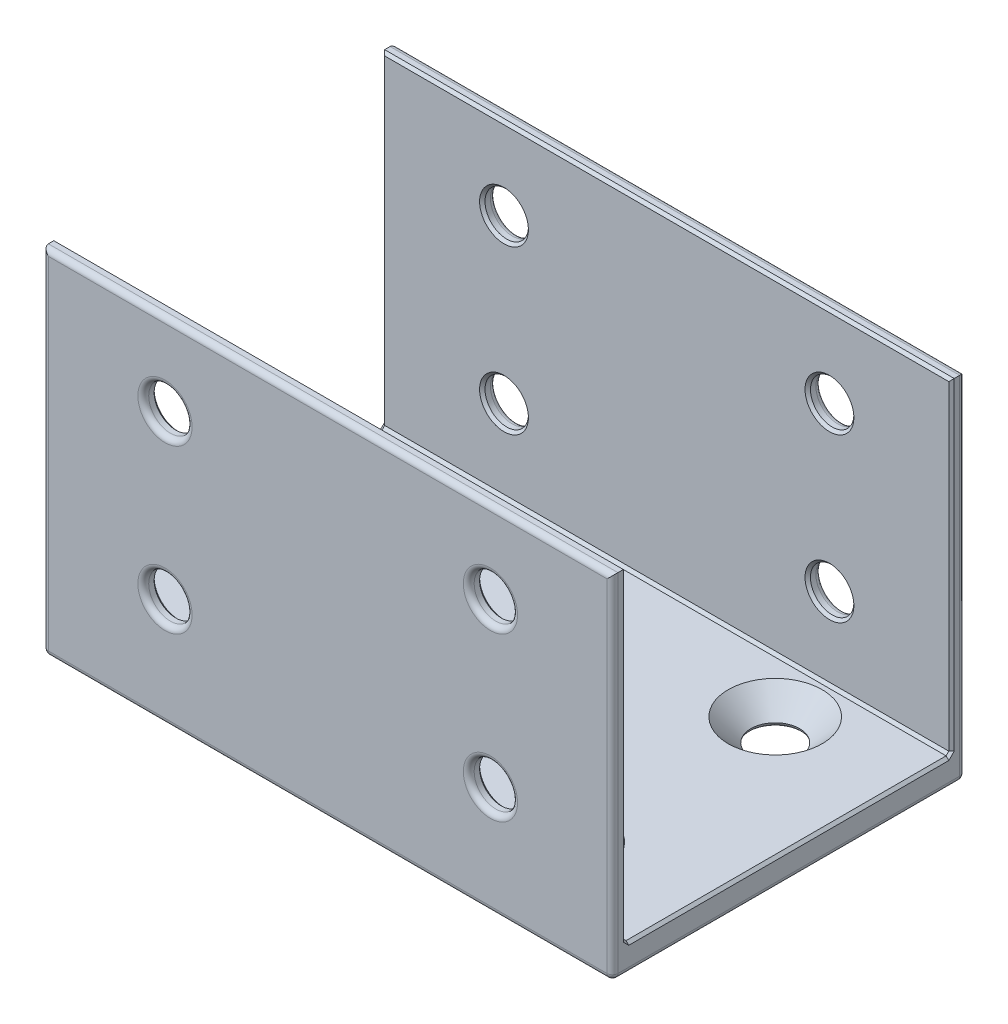
from build123d import *

# Parameters (mm, degrees)
SZKIC1_W                    = 105
SZKIC1_H                    = 65
DODANIE_WYCI_GNI_CIE1_DEPTH = 65
WYTNIJ_WYCI_GNI_CIE1_REACH  = 129.696
SZKIC2_W                    = 60
SZKIC2_H                    = 60
OTWORY_USTALAJ_CE_8_0MM2_D  = 8
ZAOKR_GLENIE1_R             = 1
SFAZOWANIE1_SIZE            = 0.5


with BuildPart() as part:
    # Szkic1 → Dodanie-wyciągnięcie1 (new body)
    with BuildSketch(Plane(origin=(0, 0, 0), x_dir=(1, 0, 0), z_dir=(0, 1, 0))):
        Rectangle(SZKIC1_W, SZKIC1_H)
    extrude(amount=DODANIE_WYCI_GNI_CIE1_DEPTH)

    # Szkic2 → Wytnij-wyciągnięcie1 (cut, up to next)
    with BuildSketch(Plane(origin=(52.5, 0, 0), x_dir=(0, 0, -1), z_dir=(1, 0, 0)), mode=Mode.PRIVATE) as wytnij_wyci_gni_cie1_sk1:
        with Locations((0, 35)):
            Rectangle(SZKIC2_W, SZKIC2_H)
    wytnij_wyci_gni_cie1_tool1 = extrude(wytnij_wyci_gni_cie1_sk1.sketch, amount=-WYTNIJ_WYCI_GNI_CIE1_REACH, mode=Mode.PRIVATE) & part.part
    add(wytnij_wyci_gni_cie1_tool1.solids().sort_by_distance((52.5, 35, 0))[0], mode=Mode.SUBTRACT)

    # Szkic5 → Pogłębienie stożkowe pod M8 Śrubę z łbem soczewkowym1 (revolve, cut)
    with BuildSketch(Plane(origin=(-30, 5, -20), x_dir=(0, 0, 1), z_dir=(1, 0, 0))):
        Polygon((0, 0), (0, 5), (4.5, 5), (4.5, 4.15), (8.65, 0), align=None)
    pog_bienie_sto_kowe_pod_m8_rub_z_bem = revolve(axis=Axis((-30, 11.35, -20), (0, -1, 0)), mode=Mode.SUBTRACT)

    # Lustro1: Pogłębienie stożkowe pod M8 Śrubę z łbem soczewkowym1 across plane
    add(pog_bienie_sto_kowe_pod_m8_rub_z_bem.mirror(Plane(origin=(0, 0, 0), x_dir=(0, 0, 1), z_dir=(1, 0, 0))), mode=Mode.SUBTRACT)

    # Lustro2: Pogłębienie stożkowe pod M8 Śrubę z łbem soczewkowym1 across plane
    add(pog_bienie_sto_kowe_pod_m8_rub_z_bem.mirror(Plane.XY), mode=Mode.SUBTRACT)

    # Lustro2 copy 1 sketch → Lustro2 copy 1 (revolve, cut)
    with BuildSketch(Plane(origin=(30, 5, 20), x_dir=(0, 0, -1), z_dir=(-1, 0, 0))):
        Polygon((0, 0), (0, 5), (4.5, 5), (4.5, 4.15), (8.65, 0), align=None)
    revolve(axis=Axis((30, 11.35, 20), (0, -1, 0)), mode=Mode.SUBTRACT)

    # Otwory ustalające Ø8.0mm2 (through all)
    with Locations(Plane.XY.offset(32.5)):
        with Locations((-30, 50), (30, 50), (30, 20), (-30, 20)):
            Hole(OTWORY_USTALAJ_CE_8_0MM2_D / 2)

    # Zaokrąglenie1
    # the kernel refuses this fillet: 1 mm, written as the material it takes off along each edge
    with BuildSketch(Plane(origin=(-51.5, 1, -31.5), x_dir=(-1, 0, 0), z_dir=(0, -1, 0))) as zaokr_glenie1_piece_1_section:
        Polygon((0, 0), (ZAOKR_GLENIE1_R * 1.02, 0), (ZAOKR_GLENIE1_R * 1.02, ZAOKR_GLENIE1_R * 1.02), (0, ZAOKR_GLENIE1_R * 1.02), align=None)
    zaokr_glenie1_piece_1 = extrude(amount=ZAOKR_GLENIE1_R * 1.02, mode=Mode.PRIVATE)
    zaokr_glenie1_piece_1 = zaokr_glenie1_piece_1 - Plane(origin=(-51.5, 1, -31.5), x_dir=(0.7071067811865477, 0, 0.7071067811865475), z_dir=(0, -1, 0)) * Sphere(ZAOKR_GLENIE1_R, mode=Mode.PRIVATE)
    add(zaokr_glenie1_piece_1, mode=Mode.SUBTRACT)
    with BuildSketch(Plane(origin=(51.5, 1, -31.5), x_dir=(0, -1, 0), z_dir=(1, 0, 0))) as zaokr_glenie1_piece_2_section:
        Polygon((0, 0), (ZAOKR_GLENIE1_R * 1.02, 0), (ZAOKR_GLENIE1_R * 1.02, ZAOKR_GLENIE1_R * 1.02), (0, ZAOKR_GLENIE1_R * 1.02), align=None)
    zaokr_glenie1_piece_2 = extrude(amount=ZAOKR_GLENIE1_R * 1.02, mode=Mode.PRIVATE)
    zaokr_glenie1_piece_2 = zaokr_glenie1_piece_2 - Plane(origin=(51.5, 1, -31.5), x_dir=(0, 0.7071067811865475, 0.7071067811865475), z_dir=(1, 0, 0)) * Sphere(ZAOKR_GLENIE1_R, mode=Mode.PRIVATE)
    add(zaokr_glenie1_piece_2, mode=Mode.SUBTRACT)
    with BuildSketch(Plane(origin=(51.5, 1, 31.5), x_dir=(1, 0, 0), z_dir=(0, 0, 1))) as zaokr_glenie1_piece_3_section:
        Polygon((0, 0), (ZAOKR_GLENIE1_R * 1.02, 0), (ZAOKR_GLENIE1_R * 1.02, -ZAOKR_GLENIE1_R * 1.02), (0, -ZAOKR_GLENIE1_R * 1.02), align=None)
    zaokr_glenie1_piece_3 = extrude(amount=ZAOKR_GLENIE1_R * 1.02, mode=Mode.PRIVATE)
    zaokr_glenie1_piece_3 = zaokr_glenie1_piece_3 - Plane(origin=(51.5, 1, 31.5), x_dir=(-0.7071067811865475, 0.7071067811865475, 0), z_dir=(0, 0, 1)) * Sphere(ZAOKR_GLENIE1_R, mode=Mode.PRIVATE)
    add(zaokr_glenie1_piece_3, mode=Mode.SUBTRACT)
    with BuildSketch(Plane(origin=(-51.5, 1, 31.5), x_dir=(0, -1, 0), z_dir=(0, 0, 1))) as zaokr_glenie1_piece_4_section:
        Polygon((0, 0), (ZAOKR_GLENIE1_R * 1.02, 0), (ZAOKR_GLENIE1_R * 1.02, -ZAOKR_GLENIE1_R * 1.02), (0, -ZAOKR_GLENIE1_R * 1.02), align=None)
    zaokr_glenie1_piece_4 = extrude(amount=ZAOKR_GLENIE1_R * 1.02, mode=Mode.PRIVATE)
    zaokr_glenie1_piece_4 = zaokr_glenie1_piece_4 - Plane(origin=(-51.5, 1, 31.5), x_dir=(0.7071067811865475, 0.7071067811865475, 0), z_dir=(0, 0, 1)) * Sphere(ZAOKR_GLENIE1_R, mode=Mode.PRIVATE)
    add(zaokr_glenie1_piece_4, mode=Mode.SUBTRACT)
    with BuildSketch(Plane(origin=(-55, 65, -32.5), x_dir=(0, 0, 1), z_dir=(1, 0, 0))) as zaokr_glenie1_piece_5:
        with BuildLine():
            CenterArc((ZAOKR_GLENIE1_R, ZAOKR_GLENIE1_R), ZAOKR_GLENIE1_R, 180, 90)
            Line((0, ZAOKR_GLENIE1_R), (-ZAOKR_GLENIE1_R * 0.02, ZAOKR_GLENIE1_R))
            Line((-ZAOKR_GLENIE1_R * 0.02, ZAOKR_GLENIE1_R), (-ZAOKR_GLENIE1_R * 0.02, -ZAOKR_GLENIE1_R * 0.02))
            Line((-ZAOKR_GLENIE1_R * 0.02, -ZAOKR_GLENIE1_R * 0.02), (ZAOKR_GLENIE1_R, -ZAOKR_GLENIE1_R * 0.02))
            Line((ZAOKR_GLENIE1_R, -ZAOKR_GLENIE1_R * 0.02), (ZAOKR_GLENIE1_R, 0))
        make_face()
    extrude(amount=110, mode=Mode.SUBTRACT)
    with BuildSketch(Plane(origin=(-30, 0, -20), x_dir=(0, 0, 1), z_dir=(1, 0, 0))) as zaokr_glenie1_piece_6:
        with BuildLine():
            CenterArc((5.488685997, -1), ZAOKR_GLENIE1_R, 90, 81.373073441)
            Line((4.5, -0.85), (4.48022628, -0.847))
            ThreePointArc((4.48022628, -0.847), (4.48, -0.425), (4.48, 0))
            Line((4.48, 0), (4.5, 0.02))
            Line((4.5, 0.02), (5.488685997, 0.02))
            Line((5.488685997, 0.02), (5.488685997, 0))
        make_face()
    revolve(axis=Axis((-30, 0, -20), (0, -1, 0)), mode=Mode.SUBTRACT)
    with BuildSketch(Plane(origin=(30, 0, -20), x_dir=(0, 0, 1), z_dir=(-1, 0, 0))) as zaokr_glenie1_piece_7:
        with BuildLine():
            CenterArc((5.488685997, 1), ZAOKR_GLENIE1_R, 188.626926559, 81.373073441)
            Line((4.5, 0.85), (4.48022628, 0.847))
            ThreePointArc((4.48022628, 0.847), (4.48, 0.425), (4.48, 0))
            Line((4.48, 0), (4.5, -0.02))
            Line((4.5, -0.02), (5.488685997, -0.02))
            Line((5.488685997, -0.02), (5.488685997, 0))
        make_face()
    revolve(axis=Axis((30, 0, -20), (0, 1, 0)), mode=Mode.SUBTRACT)
    with BuildSketch(Plane(origin=(30, 0, 20), x_dir=(0, 0, -1), z_dir=(-1, 0, 0))) as zaokr_glenie1_piece_8:
        with BuildLine():
            CenterArc((5.488685997, -1), ZAOKR_GLENIE1_R, 90, 81.373073441)
            Line((4.5, -0.85), (4.48022628, -0.847))
            ThreePointArc((4.48022628, -0.847), (4.48, -0.425), (4.48, 0))
            Line((4.48, 0), (4.5, 0.02))
            Line((4.5, 0.02), (5.488685997, 0.02))
            Line((5.488685997, 0.02), (5.488685997, 0))
        make_face()
    revolve(axis=Axis((30, 0, 20), (0, -1, 0)), mode=Mode.SUBTRACT)
    with BuildSketch(Plane(origin=(-30, 0, 20), x_dir=(0, 0, -1), z_dir=(1, 0, 0))) as zaokr_glenie1_piece_9:
        with BuildLine():
            CenterArc((5.488685997, 1), ZAOKR_GLENIE1_R, 188.626926559, 81.373073441)
            Line((4.5, 0.85), (4.48022628, 0.847))
            ThreePointArc((4.48022628, 0.847), (4.48, 0.425), (4.48, 0))
            Line((4.48, 0), (4.5, -0.02))
            Line((4.5, -0.02), (5.488685997, -0.02))
            Line((5.488685997, -0.02), (5.488685997, 0))
        make_face()
    revolve(axis=Axis((-30, 0, 20), (0, 1, 0)), mode=Mode.SUBTRACT)
    with BuildSketch(Plane(origin=(-51.5, 0, -32.5), x_dir=(0, 0, 1), z_dir=(1, 0, 0))) as zaokr_glenie1_piece_10:
        with BuildLine():
            CenterArc((ZAOKR_GLENIE1_R, -ZAOKR_GLENIE1_R), ZAOKR_GLENIE1_R, 90, 90)
            Line((0, -ZAOKR_GLENIE1_R), (-ZAOKR_GLENIE1_R * 0.02, -ZAOKR_GLENIE1_R))
            Line((-ZAOKR_GLENIE1_R * 0.02, -ZAOKR_GLENIE1_R), (-ZAOKR_GLENIE1_R * 0.02, ZAOKR_GLENIE1_R * 0.02))
            Line((-ZAOKR_GLENIE1_R * 0.02, ZAOKR_GLENIE1_R * 0.02), (ZAOKR_GLENIE1_R, ZAOKR_GLENIE1_R * 0.02))
            Line((ZAOKR_GLENIE1_R, ZAOKR_GLENIE1_R * 0.02), (ZAOKR_GLENIE1_R, 0))
        make_face()
    extrude(amount=103, mode=Mode.SUBTRACT)
    with BuildSketch(Plane(origin=(52.5, 0, -31.5), x_dir=(0, 1, 0), z_dir=(0, 0, 1))) as zaokr_glenie1_piece_11:
        with BuildLine():
            CenterArc((ZAOKR_GLENIE1_R, ZAOKR_GLENIE1_R), ZAOKR_GLENIE1_R, 180, 90)
            Line((0, ZAOKR_GLENIE1_R), (-ZAOKR_GLENIE1_R * 0.02, ZAOKR_GLENIE1_R))
            Line((-ZAOKR_GLENIE1_R * 0.02, ZAOKR_GLENIE1_R), (-ZAOKR_GLENIE1_R * 0.02, -ZAOKR_GLENIE1_R * 0.02))
            Line((-ZAOKR_GLENIE1_R * 0.02, -ZAOKR_GLENIE1_R * 0.02), (ZAOKR_GLENIE1_R, -ZAOKR_GLENIE1_R * 0.02))
            Line((ZAOKR_GLENIE1_R, -ZAOKR_GLENIE1_R * 0.02), (ZAOKR_GLENIE1_R, 0))
        make_face()
    extrude(amount=63, mode=Mode.SUBTRACT)
    with BuildSketch(Plane(origin=(51.5, 0, 32.5), x_dir=(0, 1, 0), z_dir=(-1, 0, 0))) as zaokr_glenie1_piece_12:
        with BuildLine():
            CenterArc((ZAOKR_GLENIE1_R, ZAOKR_GLENIE1_R), ZAOKR_GLENIE1_R, 180, 90)
            Line((0, ZAOKR_GLENIE1_R), (-ZAOKR_GLENIE1_R * 0.02, ZAOKR_GLENIE1_R))
            Line((-ZAOKR_GLENIE1_R * 0.02, ZAOKR_GLENIE1_R), (-ZAOKR_GLENIE1_R * 0.02, -ZAOKR_GLENIE1_R * 0.02))
            Line((-ZAOKR_GLENIE1_R * 0.02, -ZAOKR_GLENIE1_R * 0.02), (ZAOKR_GLENIE1_R, -ZAOKR_GLENIE1_R * 0.02))
            Line((ZAOKR_GLENIE1_R, -ZAOKR_GLENIE1_R * 0.02), (ZAOKR_GLENIE1_R, 0))
        make_face()
    extrude(amount=103, mode=Mode.SUBTRACT)
    with BuildSketch(Plane(origin=(-30, 20, -32.5), x_dir=(-1, 0, 0), z_dir=(0, -1, 0))) as zaokr_glenie1_piece_13:
        with BuildLine():
            CenterArc((4 + ZAOKR_GLENIE1_R, -ZAOKR_GLENIE1_R), ZAOKR_GLENIE1_R, 90, 90)
            Line((4, -ZAOKR_GLENIE1_R), (4 - ZAOKR_GLENIE1_R * 0.02, -ZAOKR_GLENIE1_R))
            Line((4 - ZAOKR_GLENIE1_R * 0.02, -ZAOKR_GLENIE1_R), (4 - ZAOKR_GLENIE1_R * 0.02, ZAOKR_GLENIE1_R * 0.02))
            Line((4 - ZAOKR_GLENIE1_R * 0.02, ZAOKR_GLENIE1_R * 0.02), (4 + ZAOKR_GLENIE1_R, ZAOKR_GLENIE1_R * 0.02))
            Line((4 + ZAOKR_GLENIE1_R, ZAOKR_GLENIE1_R * 0.02), (4 + ZAOKR_GLENIE1_R, 0))
        make_face()
    revolve(axis=Axis((-30, 20, -32.5), (0, 0, -1)), mode=Mode.SUBTRACT)
    with BuildSketch(Plane(origin=(-30, 20, 32.5), x_dir=(-1, 0, 0), z_dir=(0, -1, 0))) as zaokr_glenie1_piece_14:
        with BuildLine():
            CenterArc((4 + ZAOKR_GLENIE1_R, ZAOKR_GLENIE1_R), ZAOKR_GLENIE1_R, 180, 90)
            Line((4, ZAOKR_GLENIE1_R), (4 - ZAOKR_GLENIE1_R * 0.02, ZAOKR_GLENIE1_R))
            Line((4 - ZAOKR_GLENIE1_R * 0.02, ZAOKR_GLENIE1_R), (4 - ZAOKR_GLENIE1_R * 0.02, -ZAOKR_GLENIE1_R * 0.02))
            Line((4 - ZAOKR_GLENIE1_R * 0.02, -ZAOKR_GLENIE1_R * 0.02), (4 + ZAOKR_GLENIE1_R, -ZAOKR_GLENIE1_R * 0.02))
            Line((4 + ZAOKR_GLENIE1_R, -ZAOKR_GLENIE1_R * 0.02), (4 + ZAOKR_GLENIE1_R, 0))
        make_face()
    revolve(axis=Axis((-30, 20, 32.5), (0, 0, -1)), mode=Mode.SUBTRACT)
    with BuildSketch(Plane(origin=(-52.5, 0, 31.5), x_dir=(1, 0, 0), z_dir=(0, 0, -1))) as zaokr_glenie1_piece_15:
        with BuildLine():
            CenterArc((ZAOKR_GLENIE1_R, -ZAOKR_GLENIE1_R), ZAOKR_GLENIE1_R, 90, 90)
            Line((0, -ZAOKR_GLENIE1_R), (-ZAOKR_GLENIE1_R * 0.02, -ZAOKR_GLENIE1_R))
            Line((-ZAOKR_GLENIE1_R * 0.02, -ZAOKR_GLENIE1_R), (-ZAOKR_GLENIE1_R * 0.02, ZAOKR_GLENIE1_R * 0.02))
            Line((-ZAOKR_GLENIE1_R * 0.02, ZAOKR_GLENIE1_R * 0.02), (ZAOKR_GLENIE1_R, ZAOKR_GLENIE1_R * 0.02))
            Line((ZAOKR_GLENIE1_R, ZAOKR_GLENIE1_R * 0.02), (ZAOKR_GLENIE1_R, 0))
        make_face()
    extrude(amount=63, mode=Mode.SUBTRACT)
    with BuildSketch(Plane(origin=(30, 20, -32.5), x_dir=(-1, 0, 0), z_dir=(0, -1, 0))) as zaokr_glenie1_piece_16:
        with BuildLine():
            CenterArc((4 + ZAOKR_GLENIE1_R, -ZAOKR_GLENIE1_R), ZAOKR_GLENIE1_R, 90, 90)
            Line((4, -ZAOKR_GLENIE1_R), (4 - ZAOKR_GLENIE1_R * 0.02, -ZAOKR_GLENIE1_R))
            Line((4 - ZAOKR_GLENIE1_R * 0.02, -ZAOKR_GLENIE1_R), (4 - ZAOKR_GLENIE1_R * 0.02, ZAOKR_GLENIE1_R * 0.02))
            Line((4 - ZAOKR_GLENIE1_R * 0.02, ZAOKR_GLENIE1_R * 0.02), (4 + ZAOKR_GLENIE1_R, ZAOKR_GLENIE1_R * 0.02))
            Line((4 + ZAOKR_GLENIE1_R, ZAOKR_GLENIE1_R * 0.02), (4 + ZAOKR_GLENIE1_R, 0))
        make_face()
    revolve(axis=Axis((30, 20, -32.5), (0, 0, -1)), mode=Mode.SUBTRACT)
    with BuildSketch(Plane(origin=(30, 20, 32.5), x_dir=(-1, 0, 0), z_dir=(0, -1, 0))) as zaokr_glenie1_piece_17:
        with BuildLine():
            CenterArc((4 + ZAOKR_GLENIE1_R, ZAOKR_GLENIE1_R), ZAOKR_GLENIE1_R, 180, 90)
            Line((4, ZAOKR_GLENIE1_R), (4 - ZAOKR_GLENIE1_R * 0.02, ZAOKR_GLENIE1_R))
            Line((4 - ZAOKR_GLENIE1_R * 0.02, ZAOKR_GLENIE1_R), (4 - ZAOKR_GLENIE1_R * 0.02, -ZAOKR_GLENIE1_R * 0.02))
            Line((4 - ZAOKR_GLENIE1_R * 0.02, -ZAOKR_GLENIE1_R * 0.02), (4 + ZAOKR_GLENIE1_R, -ZAOKR_GLENIE1_R * 0.02))
            Line((4 + ZAOKR_GLENIE1_R, -ZAOKR_GLENIE1_R * 0.02), (4 + ZAOKR_GLENIE1_R, 0))
        make_face()
    revolve(axis=Axis((30, 20, 32.5), (0, 0, -1)), mode=Mode.SUBTRACT)
    with BuildSketch(Plane(origin=(30, 50, -32.5), x_dir=(-1, 0, 0), z_dir=(0, -1, 0))) as zaokr_glenie1_piece_18:
        with BuildLine():
            CenterArc((4 + ZAOKR_GLENIE1_R, -ZAOKR_GLENIE1_R), ZAOKR_GLENIE1_R, 90, 90)
            Line((4, -ZAOKR_GLENIE1_R), (4 - ZAOKR_GLENIE1_R * 0.02, -ZAOKR_GLENIE1_R))
            Line((4 - ZAOKR_GLENIE1_R * 0.02, -ZAOKR_GLENIE1_R), (4 - ZAOKR_GLENIE1_R * 0.02, ZAOKR_GLENIE1_R * 0.02))
            Line((4 - ZAOKR_GLENIE1_R * 0.02, ZAOKR_GLENIE1_R * 0.02), (4 + ZAOKR_GLENIE1_R, ZAOKR_GLENIE1_R * 0.02))
            Line((4 + ZAOKR_GLENIE1_R, ZAOKR_GLENIE1_R * 0.02), (4 + ZAOKR_GLENIE1_R, 0))
        make_face()
    revolve(axis=Axis((30, 50, -32.5), (0, 0, -1)), mode=Mode.SUBTRACT)
    with BuildSketch(Plane(origin=(30, 50, 32.5), x_dir=(-1, 0, 0), z_dir=(0, -1, 0))) as zaokr_glenie1_piece_19:
        with BuildLine():
            CenterArc((4 + ZAOKR_GLENIE1_R, ZAOKR_GLENIE1_R), ZAOKR_GLENIE1_R, 180, 90)
            Line((4, ZAOKR_GLENIE1_R), (4 - ZAOKR_GLENIE1_R * 0.02, ZAOKR_GLENIE1_R))
            Line((4 - ZAOKR_GLENIE1_R * 0.02, ZAOKR_GLENIE1_R), (4 - ZAOKR_GLENIE1_R * 0.02, -ZAOKR_GLENIE1_R * 0.02))
            Line((4 - ZAOKR_GLENIE1_R * 0.02, -ZAOKR_GLENIE1_R * 0.02), (4 + ZAOKR_GLENIE1_R, -ZAOKR_GLENIE1_R * 0.02))
            Line((4 + ZAOKR_GLENIE1_R, -ZAOKR_GLENIE1_R * 0.02), (4 + ZAOKR_GLENIE1_R, 0))
        make_face()
    revolve(axis=Axis((30, 50, 32.5), (0, 0, -1)), mode=Mode.SUBTRACT)
    with BuildSketch(Plane(origin=(-52.5, 1, -32.5), x_dir=(0, 0, 1), z_dir=(0, 1, 0)), Plane(origin=(-52.5, 1, 32.5), x_dir=(1, 0, 0), z_dir=(0, 1, 0))) as zaokr_glenie1_piece_20:
        with BuildLine():
            CenterArc((ZAOKR_GLENIE1_R, ZAOKR_GLENIE1_R), ZAOKR_GLENIE1_R, 180, 90)
            Line((0, ZAOKR_GLENIE1_R), (-ZAOKR_GLENIE1_R * 0.02, ZAOKR_GLENIE1_R))
            Line((-ZAOKR_GLENIE1_R * 0.02, ZAOKR_GLENIE1_R), (-ZAOKR_GLENIE1_R * 0.02, -ZAOKR_GLENIE1_R * 0.02))
            Line((-ZAOKR_GLENIE1_R * 0.02, -ZAOKR_GLENIE1_R * 0.02), (ZAOKR_GLENIE1_R, -ZAOKR_GLENIE1_R * 0.02))
            Line((ZAOKR_GLENIE1_R, -ZAOKR_GLENIE1_R * 0.02), (ZAOKR_GLENIE1_R, 0))
        make_face()
    extrude(amount=66.5, mode=Mode.SUBTRACT)
    with BuildSketch(Plane(origin=(52.5, 1, -32.5), x_dir=(0, 0, 1), z_dir=(0, 1, 0)), Plane(origin=(52.5, 1, 32.5), x_dir=(-1, 0, 0), z_dir=(0, 1, 0))) as zaokr_glenie1_piece_21:
        with BuildLine():
            CenterArc((ZAOKR_GLENIE1_R, -ZAOKR_GLENIE1_R), ZAOKR_GLENIE1_R, 90, 90)
            Line((0, -ZAOKR_GLENIE1_R), (-ZAOKR_GLENIE1_R * 0.02, -ZAOKR_GLENIE1_R))
            Line((-ZAOKR_GLENIE1_R * 0.02, -ZAOKR_GLENIE1_R), (-ZAOKR_GLENIE1_R * 0.02, ZAOKR_GLENIE1_R * 0.02))
            Line((-ZAOKR_GLENIE1_R * 0.02, ZAOKR_GLENIE1_R * 0.02), (ZAOKR_GLENIE1_R, ZAOKR_GLENIE1_R * 0.02))
            Line((ZAOKR_GLENIE1_R, ZAOKR_GLENIE1_R * 0.02), (ZAOKR_GLENIE1_R, 0))
        make_face()
    extrude(amount=66.5, mode=Mode.SUBTRACT)
    with BuildSketch(Plane(origin=(-30, 50, -32.5), x_dir=(-1, 0, 0), z_dir=(0, -1, 0))) as zaokr_glenie1_piece_22:
        with BuildLine():
            CenterArc((4 + ZAOKR_GLENIE1_R, -ZAOKR_GLENIE1_R), ZAOKR_GLENIE1_R, 90, 90)
            Line((4, -ZAOKR_GLENIE1_R), (4 - ZAOKR_GLENIE1_R * 0.02, -ZAOKR_GLENIE1_R))
            Line((4 - ZAOKR_GLENIE1_R * 0.02, -ZAOKR_GLENIE1_R), (4 - ZAOKR_GLENIE1_R * 0.02, ZAOKR_GLENIE1_R * 0.02))
            Line((4 - ZAOKR_GLENIE1_R * 0.02, ZAOKR_GLENIE1_R * 0.02), (4 + ZAOKR_GLENIE1_R, ZAOKR_GLENIE1_R * 0.02))
            Line((4 + ZAOKR_GLENIE1_R, ZAOKR_GLENIE1_R * 0.02), (4 + ZAOKR_GLENIE1_R, 0))
        make_face()
    revolve(axis=Axis((-30, 50, -32.5), (0, 0, -1)), mode=Mode.SUBTRACT)
    with BuildSketch(Plane(origin=(-30, 50, 32.5), x_dir=(-1, 0, 0), z_dir=(0, -1, 0))) as zaokr_glenie1_piece_23:
        with BuildLine():
            CenterArc((4 + ZAOKR_GLENIE1_R, ZAOKR_GLENIE1_R), ZAOKR_GLENIE1_R, 180, 90)
            Line((4, ZAOKR_GLENIE1_R), (4 - ZAOKR_GLENIE1_R * 0.02, ZAOKR_GLENIE1_R))
            Line((4 - ZAOKR_GLENIE1_R * 0.02, ZAOKR_GLENIE1_R), (4 - ZAOKR_GLENIE1_R * 0.02, -ZAOKR_GLENIE1_R * 0.02))
            Line((4 - ZAOKR_GLENIE1_R * 0.02, -ZAOKR_GLENIE1_R * 0.02), (4 + ZAOKR_GLENIE1_R, -ZAOKR_GLENIE1_R * 0.02))
            Line((4 + ZAOKR_GLENIE1_R, -ZAOKR_GLENIE1_R * 0.02), (4 + ZAOKR_GLENIE1_R, 0))
        make_face()
    revolve(axis=Axis((-30, 50, 32.5), (0, 0, -1)), mode=Mode.SUBTRACT)
    with BuildSketch(Plane(origin=(55, 65, 32.5), x_dir=(0, -1, 0), z_dir=(-1, 0, 0))) as zaokr_glenie1_piece_24:
        with BuildLine():
            CenterArc((ZAOKR_GLENIE1_R, -ZAOKR_GLENIE1_R), ZAOKR_GLENIE1_R, 90, 90)
            Line((0, -ZAOKR_GLENIE1_R), (-ZAOKR_GLENIE1_R * 0.02, -ZAOKR_GLENIE1_R))
            Line((-ZAOKR_GLENIE1_R * 0.02, -ZAOKR_GLENIE1_R), (-ZAOKR_GLENIE1_R * 0.02, ZAOKR_GLENIE1_R * 0.02))
            Line((-ZAOKR_GLENIE1_R * 0.02, ZAOKR_GLENIE1_R * 0.02), (ZAOKR_GLENIE1_R, ZAOKR_GLENIE1_R * 0.02))
            Line((ZAOKR_GLENIE1_R, ZAOKR_GLENIE1_R * 0.02), (ZAOKR_GLENIE1_R, 0))
        make_face()
    extrude(amount=110, mode=Mode.SUBTRACT)

    # Sfazowanie1
    sfazowanie1_edges = [part.edges().sort_by_distance(p)[0] for p in [
        (0, 65, -30),
        (0, 5, -30),
        (0, 5, 30),
        (0, 65, 30),
        (52.5, 35, -30),
        (52.5, 35, 30),
        (52.5, 5, 0),
        (-52.5, 35, -30),
        (-52.5, 5, 0),
        (-52.5, 35, 30),
        (-26, 20, 30),
        (-26, 20, -30),
        (34, 20, 30),
        (34, 20, -30),
        (34, 50, 30),
        (34, 50, -30),
        (-26, 50, 30),
        (-26, 50, -30),
    ]]
    chamfer(sfazowanie1_edges, length=SFAZOWANIE1_SIZE)


solid = part.part
